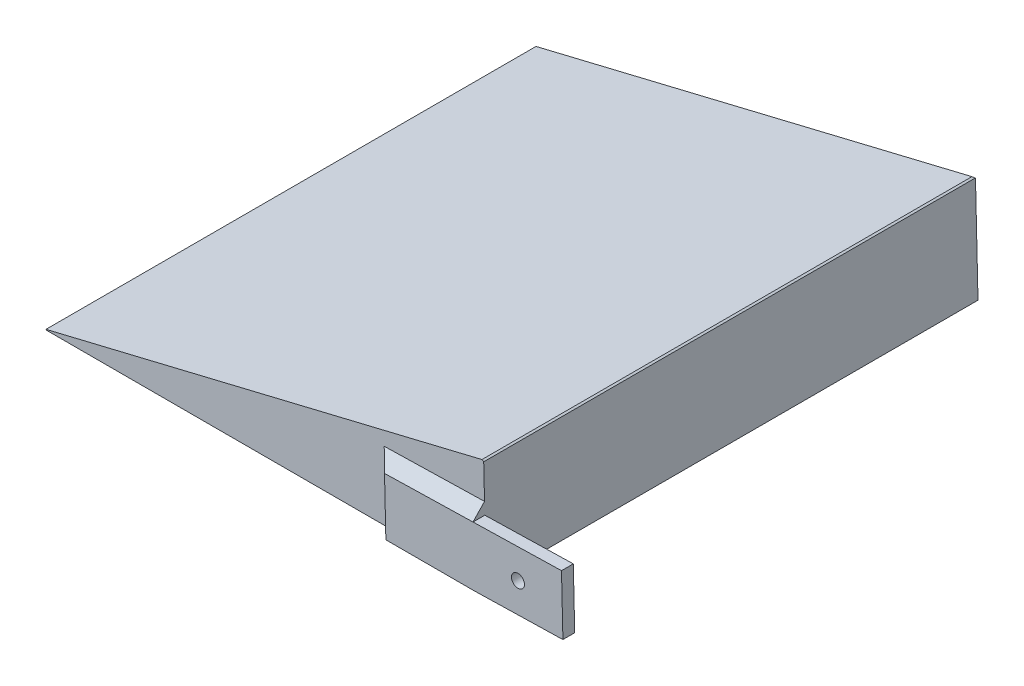
from build123d import *
from OCP.BRepFilletAPI import BRepFilletAPI_MakeChamfer

# Parameters (mm, degrees)
BOSS_EXTRUDE1_DEPTH = 166.66666666666666
CUT_EXTRUDE1_DEPTH  = 160.666666667
BOSS_EXTRUDE2_DEPTH = 4
SKETCH9_R           = 2.1999999999999833
CUT_EXTRUDE3_DEPTH  = 673.8557295952264
SKETCH10_R          = 2.1999999999999833
CUT_EXTRUDE4_DEPTH  = 3
CHAMFER3_SIZE       = 0.6
CHAMFER3_SIZE2      = 0.5047874406768073
CHAMFER4_SIZE       = 1
CHAMFER4_SIZE2      = 0.8287182147663876
CHAMFER8_SIZE       = 4
CHAMFER9_SIZE       = 4


with BuildPart() as part:
    # Sketch4 → Boss-Extrude1 (new body)
    with BuildSketch(Plane.XY):
        Polygon((-500.7204776760873, 35.989612544106855), (-649.8557297792629, -1.837e-14), (-499.8557297792629, -6.121e-14), align=None)
    extrude(amount=-BOSS_EXTRUDE1_DEPTH)

    # Sketch6 → Cut-Extrude1 (cut)
    with BuildSketch(Plane.XY.offset(-3)):
        Polygon((-504.85717289786834, -1.837e-14), (-505.570212772658, 29.675734299461347), (-585.1090138943516, 10.481274275937695), (-584.8571728978683, -1.837e-14), align=None)
    extrude(amount=-CUT_EXTRUDE1_DEPTH, mode=Mode.SUBTRACT)

    # Sketch8 → Boss-Extrude2 (add)
    with BuildSketch(Plane.XY):
        Polygon((-500.3361452774986, 19.994229191170454), (-470.34480149074295, 20.714852438524037), (-469.86438599250715, 0.720623247353527), (-499.8557297792629, -6.121e-14), (-529.8643884908956, -2.204e-14), (-530.3274890642546, 19.273605943816776), align=None)
    extrude(amount=BOSS_EXTRUDE2_DEPTH)

    # Sketch9 → Cut-Extrude3 (cut, through all)
    with BuildSketch(Plane.XY.offset(4)):
        with Locations((-485.1002656350029, 10.357426219261987)):
            Circle(SKETCH9_R)
    extrude(amount=-CUT_EXTRUDE3_DEPTH, mode=Mode.SUBTRACT)

    # Sketch10 → Cut-Extrude4 (cut)
    with BuildSketch(Plane(origin=(0, 0, -166.66666666666666), x_dir=(-1, 0, 0), z_dir=(0, 0, -1))):
        with Locations((513.1478143821638, 11.99999999999998)):
            Circle(SKETCH10_R)
        with Locations((527.1478143821638, 11.99999999999998)):
            Circle(SKETCH10_R)
    extrude(amount=-CUT_EXTRUDE4_DEPTH, mode=Mode.SUBTRACT)

    # Chamfer3: one chamfer whose edges measure the first distance from different faces: ONE call of the kernel's chamfer builder (chamfer() names one face for all edges)
    chamfer3_edges_1 = [part.edges().sort_by_distance(p)[0] for p in [
        (-500.7204776760873, 35.989612544106855, -83.33333333333333),
    ]]
    chamfer3_side_1 = [part.faces().sort_by_distance(p)[0] for p in [
        (-575.2881037276751, 17.994806272053417, -83.33333333333333),
    ]]
    chamfer3_edges_2 = [part.edges().sort_by_distance(p)[0] for p in [
        (-575.2881037276751, 17.994806272053417, -166.66666666666666),
    ]]
    chamfer3 = BRepFilletAPI_MakeChamfer(part.part.solid().wrapped)
    for e in chamfer3_edges_1:
        chamfer3.Add(CHAMFER3_SIZE, CHAMFER3_SIZE2, e.wrapped, chamfer3_side_1[0].wrapped)  # the first distance lies on this face
    for e in chamfer3_edges_2:
        chamfer3.Add(CHAMFER3_SIZE, e.wrapped)
    add(Compound.cast(chamfer3.Shape()), mode=Mode.REPLACE)

    # Chamfer4
    chamfer4_edges = [part.edges().sort_by_distance(p)[0] for p in [
        (-649.8557297792629, -1.837e-14, -83.03333333333336),
    ]]
    chamfer4_side = [part.faces().sort_by_distance(p)[0] for p in [
        (-605.6991208479849, -3.098e-14, -82.49305945140193),
    ]]
    chamfer(chamfer4_edges, length=CHAMFER4_SIZE, length2=CHAMFER4_SIZE2, reference=chamfer4_side[0])

    # Chamfer8
    chamfer8_edges = [part.edges().sort_by_distance(p)[0] for p in [
        (-515.3318171708765, 19.633917567493594, 0),
    ]]
    chamfer(chamfer8_edges, length=CHAMFER8_SIZE - 0.0001)  # a hair under: the kernel refuses the full size

    # Chamfer9
    chamfer9_edges = [part.edges().sort_by_distance(p)[0] for p in [
        (-530.1439791263599, 11.636175905452475, 0),
    ]]
    chamfer(chamfer9_edges, length=CHAMFER9_SIZE - 0.0001)  # a hair under: the kernel refuses the full size


solid = part.part
